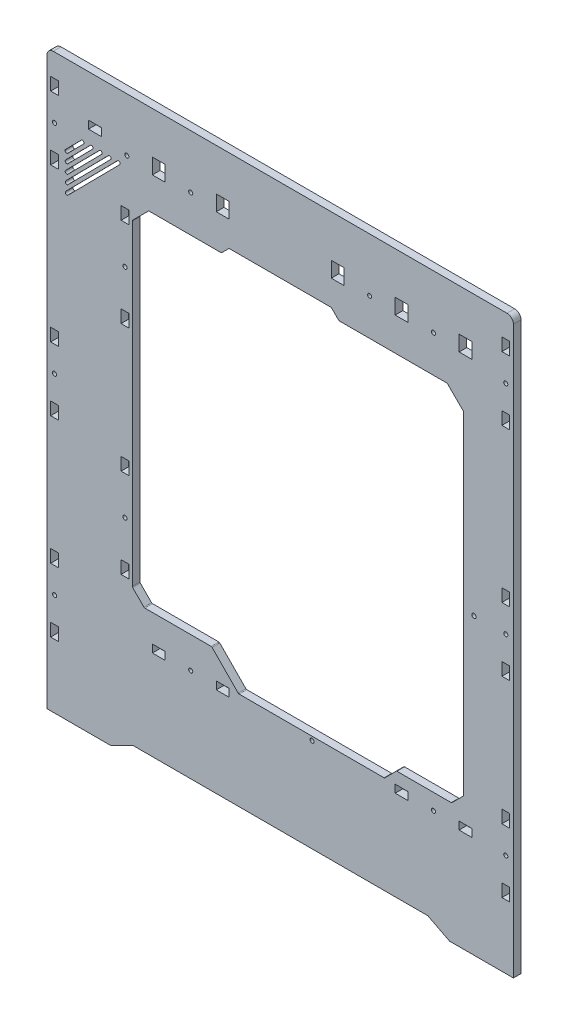
from build123d import *

# Parameters (mm, degrees)
SKETCH_1_W      = 6.1
SKETCH_1_H      = 10
SKETCH_1_R      = 1.6
SKETCH_1_W_2    = 10
SKETCH_1_H_2    = 6.1
SKETCH_1_H_3    = 12.1
SKETCH_1_R_2    = 1.7
EXTRUDE_1_DEPTH = 6


with BuildPart() as part:
    # Эскиз1 → Бобышка-Вытянуть1 (new body)
    with BuildSketch(Plane.XY):
        with BuildLine():
            Line((909.866546195, 490.00723929), (830.508682195, 490.00723929))
            Line((830.508682195, 490.00723929), (773.366546195, 490.00723929))
            ThreePointArc((773.366546195, 490.00723929), (769.831012289, 488.542773196), (768.366546195, 485.00723929))
            Line((768.366546195, 485.00723929), (768.366546195, 477.00723929))
            Line((768.366546195, 477.00723929), (768.366546195, 42.00723929))
            Line((768.366546195, 42.00723929), (818.366546195, 42.00723929))
            Line((818.366546195, 42.00723929), (835.366546195, 50.73749629))
            Line((835.366546195, 50.73749629), (1066.366546195, 50.73749629))
            Line((1066.366546195, 50.73749629), (1083.366546195, 42.00723929))
            Line((1083.366546195, 42.00723929), (1133.366546195, 42.00723929))
            Line((1133.366546195, 42.00723929), (1133.366546195, 477.00723929))
            Line((1133.366546195, 477.00723929), (1133.366546195, 485.00723929))
            ThreePointArc((1133.366546195, 485.00723929), (1131.902080101, 488.542773196), (1128.366546195, 490.00723929))
            Line((1128.366546195, 490.00723929), (909.866546195, 490.00723929))
        make_face()
        with Locations((774.316546195, 97.00723929)):
            Rectangle(SKETCH_1_W, SKETCH_1_H, mode=Mode.SUBTRACT)
        with Locations((774.316546195, 122.00723929)):
            Circle(SKETCH_1_R, mode=Mode.SUBTRACT)
        with Locations((774.316546195, 147.00723929)):
            Rectangle(SKETCH_1_W, SKETCH_1_H, mode=Mode.SUBTRACT)
        with Locations((855.866546195, 124.05491429)):
            Rectangle(SKETCH_1_W_2, SKETCH_1_H_2, mode=Mode.SUBTRACT)
        with Locations((880.866546195, 124.05491429)):
            Circle(SKETCH_1_R, mode=Mode.SUBTRACT)
        with Locations((905.866546195, 124.05491429)):
            Rectangle(SKETCH_1_W_2, SKETCH_1_H_2, mode=Mode.SUBTRACT)
        with Locations((829.416546195, 167.00723929)):
            Rectangle(SKETCH_1_W, SKETCH_1_H, mode=Mode.SUBTRACT)
        with Locations((829.416546195, 202.00723929)):
            Circle(SKETCH_1_R, mode=Mode.SUBTRACT)
        with Locations((774.316546195, 247.00723929)):
            Rectangle(SKETCH_1_W, SKETCH_1_H, mode=Mode.SUBTRACT)
        with Locations((829.416546195, 237.00723929)):
            Rectangle(SKETCH_1_W, SKETCH_1_H, mode=Mode.SUBTRACT)
        with Locations((975.866546195, 124.05491402)):
            Circle(SKETCH_1_R, mode=Mode.SUBTRACT)
        with Locations((1127.416546195, 97.00723929)):
            Rectangle(SKETCH_1_W, SKETCH_1_H, mode=Mode.SUBTRACT)
        with Locations((1045.866546195, 124.05491429)):
            Rectangle(SKETCH_1_W_2, SKETCH_1_H_2, mode=Mode.SUBTRACT)
        with Locations((1070.866546195, 124.05491429)):
            Circle(SKETCH_1_R, mode=Mode.SUBTRACT)
        with Locations((1095.866546195, 124.05491429)):
            Rectangle(SKETCH_1_W_2, SKETCH_1_H_2, mode=Mode.SUBTRACT)
        with Locations((1127.416546195, 122.00723929)):
            Circle(SKETCH_1_R, mode=Mode.SUBTRACT)
        with Locations((1127.416546195, 147.00723929)):
            Rectangle(SKETCH_1_W, SKETCH_1_H, mode=Mode.SUBTRACT)
        with Locations((1127.416546195, 247.00723929)):
            Rectangle(SKETCH_1_W, SKETCH_1_H, mode=Mode.SUBTRACT)
        with Locations((774.316546195, 272.00723929)):
            Circle(SKETCH_1_R, mode=Mode.SUBTRACT)
        with Locations((774.316546195, 297.00723929)):
            Rectangle(SKETCH_1_W, SKETCH_1_H, mode=Mode.SUBTRACT)
        with Locations((829.416546195, 337.00723929)):
            Rectangle(SKETCH_1_W, SKETCH_1_H, mode=Mode.SUBTRACT)
        with Locations((829.416546195, 372.00723929)):
            Circle(SKETCH_1_R, mode=Mode.SUBTRACT)
        with Locations((774.316546195, 417.00723929)):
            Rectangle(SKETCH_1_W, SKETCH_1_H, mode=Mode.SUBTRACT)
        with BuildLine():
            Line((797.021693195, 438.99752529), (784.715878195, 426.55498029))
            ThreePointArc((784.715878195, 426.55498029), (782.948138695, 426.54521379), (782.938372195, 428.31295329))
            Line((782.938372195, 428.31295329), (795.244186195, 440.75549829))
            ThreePointArc((795.244186195, 440.75549829), (797.011926195, 440.76526529), (797.021693195, 438.99752529))
        make_face(mode=Mode.SUBTRACT)
        with BuildLine():
            Line((825.305532195, 439.15378929), (784.872143195, 398.27114029))
            ThreePointArc((784.872143195, 398.27114029), (783.104403195, 398.26137329), (783.094636195, 400.02911329))
            Line((783.094636195, 400.02911329), (823.528026195, 440.91176329))
            ThreePointArc((823.528026195, 440.91176329), (825.295766195, 440.92152929), (825.305532195, 439.15378929))
        make_face(mode=Mode.SUBTRACT)
        with BuildLine():
            Line((818.234572195, 439.11472329), (784.833077195, 405.34210029))
            ThreePointArc((784.833077195, 405.34210029), (783.065337195, 405.33233329), (783.055570195, 407.10007329))
            Line((783.055570195, 407.10007329), (816.457066195, 440.87269729))
            ThreePointArc((816.457066195, 440.87269729), (818.224806195, 440.88246329), (818.234572195, 439.11472329))
        make_face(mode=Mode.SUBTRACT)
        with BuildLine():
            Line((811.163612195, 439.07565729), (784.794011195, 412.41306029))
            ThreePointArc((784.794011195, 412.41306029), (783.026271195, 412.40329329), (783.016504195, 414.17103329))
            Line((783.016504195, 414.17103329), (809.386106195, 440.83363129))
            ThreePointArc((809.386106195, 440.83363129), (811.153846195, 440.84339729), (811.163612195, 439.07565729))
        make_face(mode=Mode.SUBTRACT)
        with BuildLine():
            Line((804.092652195, 439.03659129), (784.754944195, 419.48402029))
            ThreePointArc((784.754944195, 419.48402029), (782.987204695, 419.47425379), (782.977438195, 421.24199329))
            Line((782.977438195, 421.24199329), (802.315146195, 440.79456529))
            ThreePointArc((802.315146195, 440.79456529), (804.082886195, 440.80433129), (804.092652195, 439.03659129))
        make_face(mode=Mode.SUBTRACT)
        with Locations((829.416546195, 407.00723929)):
            Rectangle(SKETCH_1_W, SKETCH_1_H, mode=Mode.SUBTRACT)
        with Locations((774.316546195, 442.00723929)):
            Circle(SKETCH_1_R, mode=Mode.SUBTRACT)
        with Locations((805.866546195, 454.05723929)):
            Rectangle(SKETCH_1_W_2, SKETCH_1_H_2, mode=Mode.SUBTRACT)
        with Locations((774.316546195, 467.00723929)):
            Rectangle(SKETCH_1_W, SKETCH_1_H, mode=Mode.SUBTRACT)
        with Locations((830.866546195, 448.05723929)):
            Circle(SKETCH_1_R, mode=Mode.SUBTRACT)
        with Locations((855.866546195, 451.05723929)):
            Rectangle(SKETCH_1_W_2, SKETCH_1_H_3, mode=Mode.SUBTRACT)
        with Locations((880.866546195, 448.05723929)):
            Circle(SKETCH_1_R, mode=Mode.SUBTRACT)
        with Locations((905.866546195, 451.05723929)):
            Rectangle(SKETCH_1_W_2, SKETCH_1_H_3, mode=Mode.SUBTRACT)
        with BuildLine():
            Line((991.452332632, 424.583526443), (996.280759757, 419.755099318))
            ThreePointArc((996.280759757, 419.755099318), (996.929606455, 419.321553816), (997.694973319, 419.169312881))
            Line((997.694973319, 419.169312881), (1081.122260515, 419.169312881))
            ThreePointArc((1081.122260515, 419.169312881), (1081.50331118, 419.093867148), (1081.826864515, 418.878913881))
            Line((1081.826864515, 418.878913881), (1094.120077515, 406.672272881))
            ThreePointArc((1094.120077515, 406.672272881), (1094.338675602, 406.346986998), (1094.415473515, 405.962671881))
            Line((1094.415473515, 405.962671881), (1094.415473515, 146.420031881))
            ThreePointArc((1094.415473515, 146.420031881), (1094.340368819, 146.039810505), (1094.126336515, 145.716701881))
            Line((1094.126336515, 145.716701881), (1085.357153515, 136.853593881))
            ThreePointArc((1085.357153515, 136.853593881), (1085.031432616, 136.634066807), (1084.646289515, 136.556923881))
            Line((1084.646289515, 136.556923881), (1042.289008515, 136.556923881))
            ThreePointArc((1042.289008515, 136.556923881), (1041.903865529, 136.479781416), (1041.578144515, 136.260254881))
            Line((1041.578144515, 136.260254881), (1032.813350515, 127.401582881))
            ThreePointArc((1032.813350515, 127.401582881), (1032.487630078, 127.182055999), (1032.102487515, 127.104912881))
            Line((1032.102487515, 127.104912881), (918.728979515, 127.104912881))
            ThreePointArc((918.728979515, 127.104912881), (918.34230769, 127.182695398), (918.015788515, 127.403942881))
            Line((918.015788515, 127.403942881), (897.574498515, 148.201603881))
            ThreePointArc((897.574498515, 148.201603881), (897.24797934, 148.422851364), (896.861307515, 148.500633881))
            Line((896.861307515, 148.500633881), (844.938460515, 148.500633881))
            ThreePointArc((844.938460515, 148.500633881), (844.553318068, 148.577776538), (844.227597515, 148.797302881))
            Line((844.227597515, 148.797302881), (835.458413515, 157.660410881))
            ThreePointArc((835.458413515, 157.660410881), (835.244381748, 157.983519619), (835.169277515, 158.363740881))
            Line((835.169277515, 158.363740881), (835.169277515, 405.962671881))
            ThreePointArc((835.169277515, 405.962671881), (835.246075427, 406.346986998), (835.464673515, 406.672272881))
            Line((835.464673515, 406.672272881), (847.757886515, 418.878913881))
            ThreePointArc((847.757886515, 418.878913881), (848.08143985, 419.093867148), (848.462490515, 419.169312881))
            Line((848.462490515, 419.169312881), (904.03811907, 419.169312881))
            ThreePointArc((904.03811907, 419.169312881), (904.803485935, 419.321553816), (905.452332632, 419.755099318))
            Line((905.452332632, 419.755099318), (910.280759757, 424.583526443))
            ThreePointArc((910.280759757, 424.583526443), (910.929606455, 425.017071946), (911.694973319, 425.169312881))
            Line((911.694973319, 425.169312881), (990.03811907, 425.169312881))
            ThreePointArc((990.03811907, 425.169312881), (990.803485935, 425.017071946), (991.452332632, 424.583526443))
        make_face(mode=Mode.SUBTRACT)
        with Locations((1102.521049053, 272.00723929)):
            Circle(SKETCH_1_R_2, mode=Mode.SUBTRACT)
        with Locations((1127.416546195, 272.00723929)):
            Circle(SKETCH_1_R, mode=Mode.SUBTRACT)
        with Locations((1127.416546195, 297.00723929)):
            Rectangle(SKETCH_1_W, SKETCH_1_H, mode=Mode.SUBTRACT)
        with Locations((995.866546195, 451.05723929)):
            Rectangle(SKETCH_1_W_2, SKETCH_1_H_3, mode=Mode.SUBTRACT)
        with Locations((1020.866546195, 448.05723929)):
            Circle(SKETCH_1_R, mode=Mode.SUBTRACT)
        with Locations((1127.416546195, 417.00723929)):
            Rectangle(SKETCH_1_W, SKETCH_1_H, mode=Mode.SUBTRACT)
        with Locations((1045.866546195, 451.05723929)):
            Rectangle(SKETCH_1_W_2, SKETCH_1_H_3, mode=Mode.SUBTRACT)
        with Locations((1070.866546195, 448.05723929)):
            Circle(SKETCH_1_R, mode=Mode.SUBTRACT)
        with Locations((1095.866546195, 451.05723929)):
            Rectangle(SKETCH_1_W_2, SKETCH_1_H_3, mode=Mode.SUBTRACT)
        with Locations((1127.416546195, 442.00723929)):
            Circle(SKETCH_1_R, mode=Mode.SUBTRACT)
        with Locations((1127.416546195, 467.00723929)):
            Rectangle(SKETCH_1_W, SKETCH_1_H, mode=Mode.SUBTRACT)
    extrude(amount=EXTRUDE_1_DEPTH)


solid = part.part
